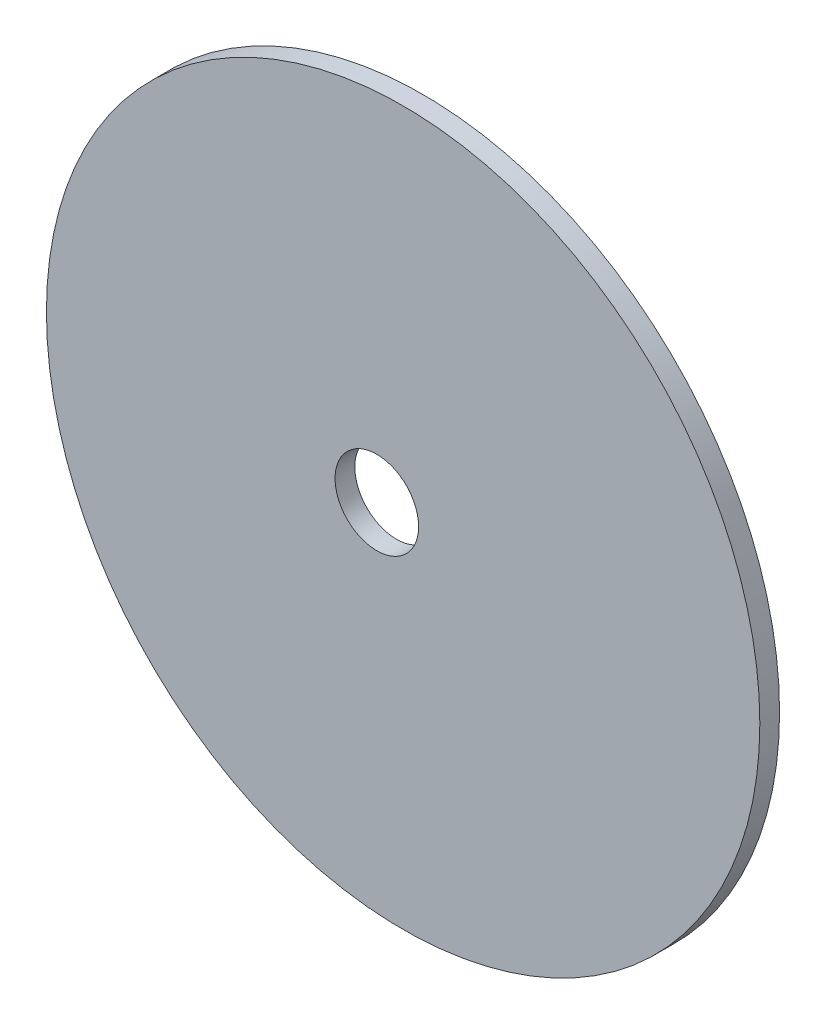
from build123d import *

# Parameters (mm, degrees)
SKETCH1_R           = 54.227105716
SKETCH1_R_2         = 6.35
BOSS_EXTRUDE5_DEPTH = 3


with BuildPart() as part:
    # Sketch1 → Boss-Extrude5 (new body)
    with BuildSketch(Plane.XY):
        Circle(SKETCH1_R)
        with Locations((-4, 0)):
            Circle(SKETCH1_R_2, mode=Mode.SUBTRACT)
    extrude(amount=BOSS_EXTRUDE5_DEPTH)


solid = part.part
